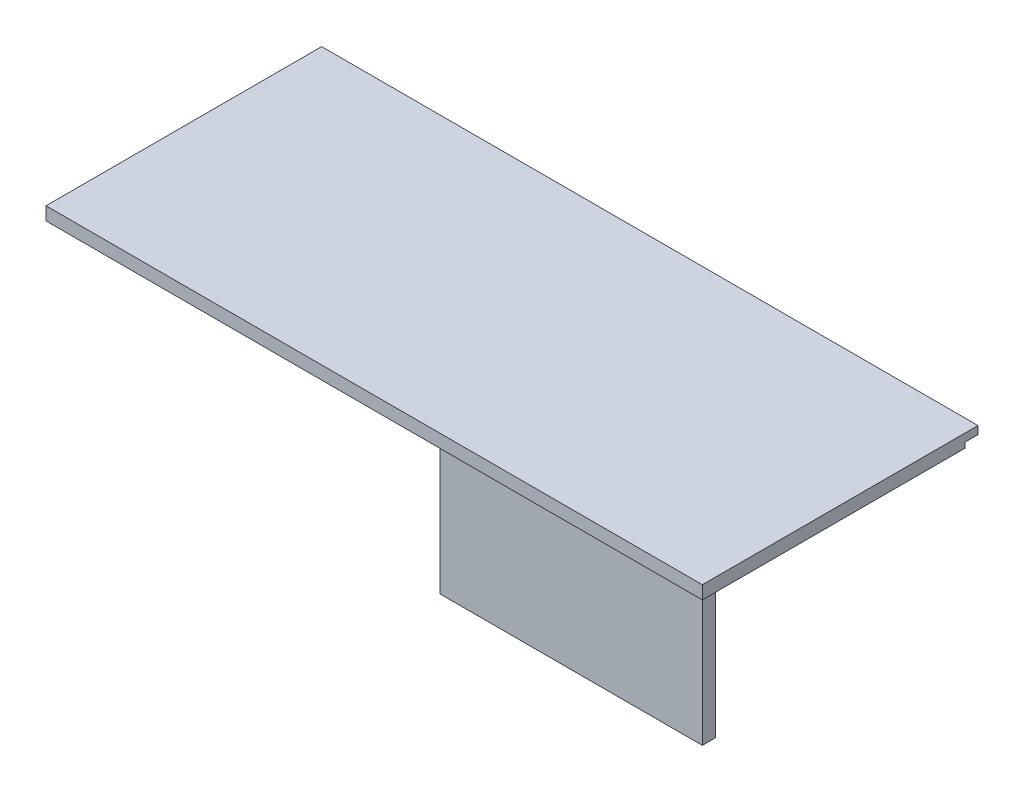
from build123d import *

# Parameters (mm, degrees)
BOSS_EXTRUDE3_DEPTH      = 150
BOSS_EXTRUDE3_DEPTH_BACK = 100
BOSS_EXTRUDE4_DEPTH      = 50


with BuildPart() as part:
    # Sketch2 → Boss-Extrude3 (new, two sides: drawn at the far end of the back side and taken through both)
    with BuildSketch(Plane(origin=(0, 0, 0), x_dir=(0, 0, -1), z_dir=(1, 0, 0)).offset(-BOSS_EXTRUDE3_DEPTH_BACK)):
        Polygon((-35, 0), (0, 0), (0, 2), (5, 2), (5, 5), (-100, 5), (-100, 0), align=None)
    extrude(amount=BOSS_EXTRUDE3_DEPTH + BOSS_EXTRUDE3_DEPTH_BACK)


with BuildPart() as body_2:
    # Sketch2<3> → Boss-Extrude4 (new, symmetric)
    with BuildSketch(Plane(origin=(0, 0, 0), x_dir=(0, 0, -1), z_dir=(1, 0, 0))):
        Polygon((0, 2), (0, 0), (0, -35), (0, -148), (5, -148), (5, 2), align=None)
    extrude(amount=BOSS_EXTRUDE4_DEPTH, both=True)


solid = Compound([part.part, body_2.part])
